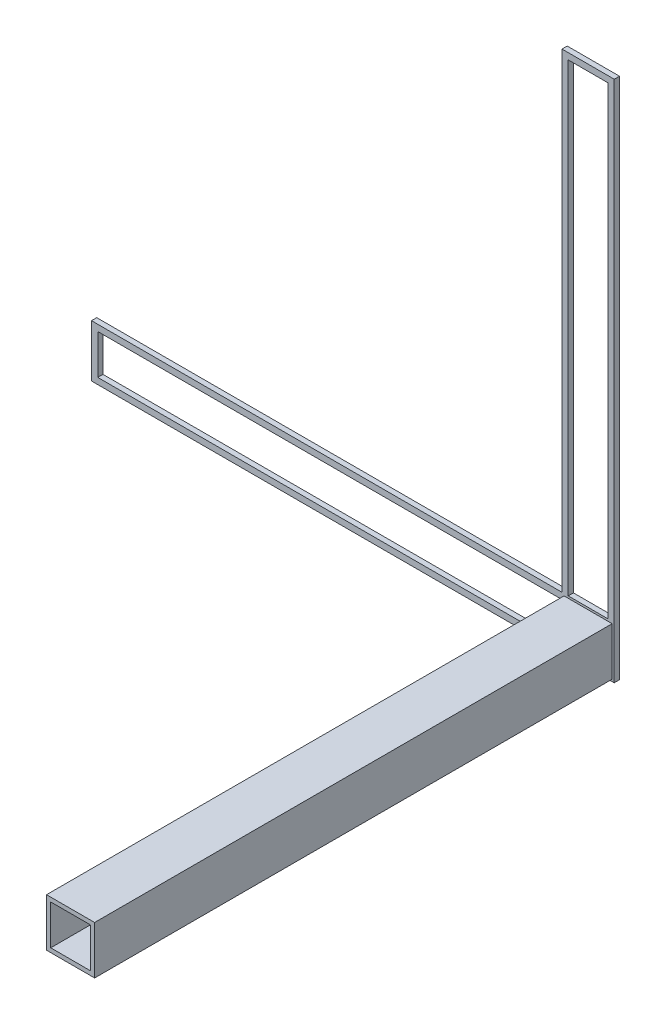
from build123d import *

# Parameters (mm, degrees)
EXTRUDE_1_OUTLINE_W   = 88.8
EXTRUDE_1_OUTLINE_H   = 7.6
EXTRUDE_1_OUTLINE_W_2 = 7.6
EXTRUDE_1_OUTLINE_H_2 = 88.8
EXTRUDE_1_DEPTH       = 1
SKETCH_2_W            = 9.2
SKETCH_2_H            = 9.2
SKETCH_2_W_2          = 7.6
SKETCH_2_H_2          = 7.6
EXTRUDE_2_DEPTH       = 99


# Read off the part's stored shape, not the designer's step: 拉伸-薄壁1
with BuildPart() as part:
    # 拉伸-薄壁1 outline → 拉伸-薄壁1 (new body)
    with BuildSketch(Plane.XY):
        Polygon((-73.979591837, 5.816326531), (-73.979591837, -4.183673469), (26.020408163, -4.183673469), (26.020408163, 95.816326531), (16.020408163, 95.816326531), (16.020408163, 5.816326531), align=None)
        with Locations((-28.379591837, 0.816326531)):
            Rectangle(EXTRUDE_1_OUTLINE_W, EXTRUDE_1_OUTLINE_H, mode=Mode.SUBTRACT)
        with Locations((21.020408163, 0.816326531)):
            Rectangle(EXTRUDE_1_OUTLINE_W_2, EXTRUDE_1_OUTLINE_H, mode=Mode.SUBTRACT)
        with Locations((21.020408163, 50.216326531)):
            Rectangle(EXTRUDE_1_OUTLINE_W_2, EXTRUDE_1_OUTLINE_H_2, mode=Mode.SUBTRACT)
    extrude(amount=EXTRUDE_1_DEPTH)

    # 草图2 → 拉伸-薄壁2 (add)
    with BuildSketch(Plane.XY.offset(1)):
        with Locations((21.020408163, 0.816326531)):
            Rectangle(SKETCH_2_W, SKETCH_2_H)
        with Locations((21.020408163, 0.816326531)):
            Rectangle(SKETCH_2_W_2, SKETCH_2_H_2, mode=Mode.SUBTRACT)
    extrude(amount=EXTRUDE_2_DEPTH)


solid = part.part
